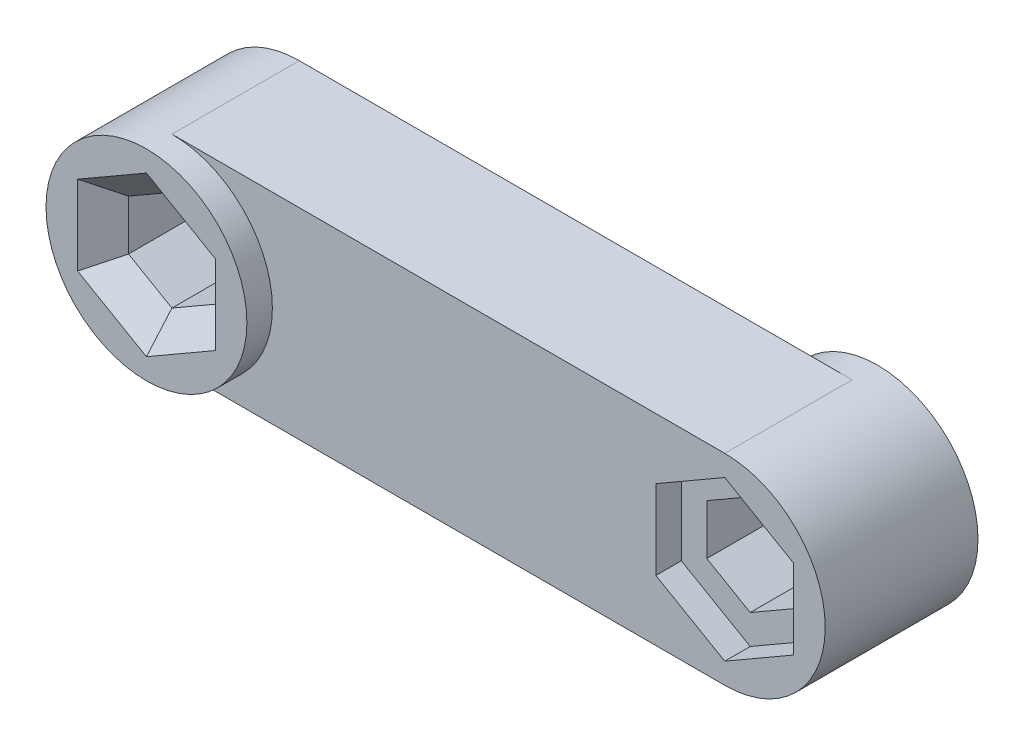
from build123d import *

# Parameters (mm, degrees)
BOSS_EXTRU_1_DEPTH      = 10
BOSS_EXTRU_3_START      = 2
BOSS_EXTRU_3_DEPTH      = 2
BOSS_EXTRU_4_DEPTH      = 2
ENL_V_MAT_EXTRU_2_DEPTH = 2
ENL_V_MAT_EXTRU_3_DEPTH = 2
CHANFREIN1_SIZE         = 2


with BuildPart() as part:
    # Esquisse1 → Boss.-Extru.1 (new body)
    with BuildSketch(Plane(origin=(0, 0, 0), x_dir=(0, 1, 0), z_dir=(0, 0, 1))):
        with BuildLine():
            Line((-7.89, -21.71), (-7.89, 21.71))
            ThreePointArc((-7.89, 21.71), (0, 29.6), (7.89, 21.71))
            Line((7.89, 21.71), (7.89, -21.71))
            ThreePointArc((7.89, -21.71), (0, -29.6), (-7.89, -21.71))
        make_face()
        Polygon((-1.968764418, -18.3), (-3.937528836, -21.71), (-1.968764418, -25.12), (1.968764418, -25.12), (3.937528836, -21.71), (1.968764418, -18.3), align=None, mode=Mode.SUBTRACT)
        Polygon((1.968764418, 18.3), (-1.968764418, 18.3), (-3.937528836, 21.71), (-1.968764418, 25.12), (1.968764418, 25.12), (3.937528836, 21.71), align=None, mode=Mode.SUBTRACT)
    extrude(amount=BOSS_EXTRU_1_DEPTH)

    # Esquisse3 → Boss.-Extru.3 (add)
    with BuildSketch(Plane(origin=(0, 0, 0), x_dir=(1, 0, 0), z_dir=(0, 0, -1)).offset(BOSS_EXTRU_3_START)):
        with BuildLine():
            ThreePointArc((21.71, -7.89), (27.289072504, -5.579072504), (29.6, 0))
            ThreePointArc((29.6, 0), (27.289072504, 5.579072504), (21.71, 7.89))
            ThreePointArc((21.71, 7.89), (13.82, 0), (21.71, -7.89))
        make_face()
        Polygon((21.71, -3.937528836), (18.3, -1.968764418), (18.3, 1.968764418), (21.71, 3.937528836), (25.12, 1.968764418), (25.12, -1.968764418), align=None, mode=Mode.SUBTRACT)
    extrude(amount=-BOSS_EXTRU_3_DEPTH)

    # Esquisse4 → Boss.-Extru.4 (add)
    with BuildSketch(Plane.XY.offset(10)):
        with BuildLine():
            ThreePointArc((-21.71, -7.89), (-16.130927496, -5.579072504), (-13.82, 0))
            ThreePointArc((-13.82, 0), (-16.130927496, 5.579072504), (-21.71, 7.89))
            ThreePointArc((-21.71, 7.89), (-29.6, 0), (-21.71, -7.89))
        make_face()
        Polygon((-25.12, -1.968764418), (-25.12, 1.968764418), (-21.71, 3.937528836), (-18.3, 1.968764418), (-18.3, -1.968764418), (-21.71, -3.937528836), align=None, mode=Mode.SUBTRACT)
    extrude(amount=BOSS_EXTRU_4_DEPTH)

    # Esquisse5 → Enlèv. mat.-Extru.2 (cut)
    with BuildSketch(Plane(origin=(0, 0, 0), x_dir=(1, 0, 0), z_dir=(0, 0, -1))):
        Polygon((-16.3, -3.123464956), (-16.3, 3.123464956), (-21.71, 6.246929913), (-27.12, 3.123464956), (-27.12, -3.123464956), (-21.71, -6.246929913), align=None)
    extrude(amount=-ENL_V_MAT_EXTRU_2_DEPTH, mode=Mode.SUBTRACT)

    # Esquisse6 → Enlèv. mat.-Extru.3 (cut)
    with BuildSketch(Plane.XY.offset(10)):
        Polygon((27.12, -3.123464956), (27.12, 3.123464956), (21.71, 6.246929913), (16.3, 3.123464956), (16.3, -3.123464956), (21.71, -6.246929913), align=None)
    extrude(amount=-ENL_V_MAT_EXTRU_3_DEPTH, mode=Mode.SUBTRACT)

    # Chanfrein1
    chanfrein1_edges = [part.edges().sort_by_distance(p)[0] for p in [
        (20.005, 2.953146627, -2),
        (18.3, 0, -2),
        (20.005, -2.953146627, -2),
        (23.415, -2.953146627, -2),
        (25.12, 0, -2),
        (23.415, 2.953146627, -2),
        (-25.12, 0, 12),
        (-23.415, 2.953146627, 12),
        (-20.005, 2.953146627, 12),
        (-18.3, 0, 12),
        (-20.005, -2.953146627, 12),
        (-23.415, -2.953146627, 12),
    ]]
    chamfer(chanfrein1_edges, length=CHANFREIN1_SIZE - 0.0001)  # a hair under: the kernel refuses the full size


solid = part.part
